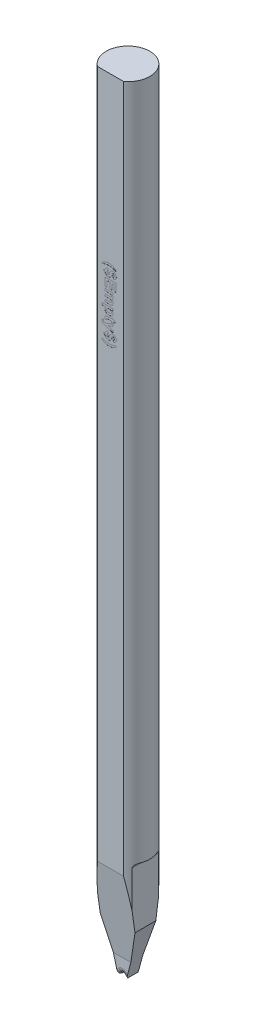
from build123d import *

# Parameters (mm, degrees)
SKETCH_TL_CUTTING_R       = 1.99771
TL_CUTTING_DEPTH          = 72.009
SKETCH_TDF_GRINDING_W     = 4.01542
SKETCH_TDF_GRINDING_H     = 4.01542
TDF_GRINDING_DEPTH        = 73.064400167
ENGRAVING_DEPTH           = 0.005
VW_VR_GRINDING_DEPTH      = 2.00771
VW_VR_GRINDING_DEPTH_BACK = 2.00771
ISA_GRINDING_DEPTH        = 2.00771
ISA_GRINDING_DEPTH_BACK   = 2.00771
PRE_FRX_BRX_DEPTH         = 2.00771
PRE_FRX_BRX_DEPTH_BACK    = 2.00771
SKETCH_PRE_FRX_BRX_W      = 1.46796
SKETCH_PRE_FRX_BRX_H      = 1.4986
FR_EDM_R                  = 0.39878
BR_EDM_R                  = 0.20066
FA_BA_GRINDING_DEPTH      = 2.00771
FA_BA_GRINDING_DEPTH_BACK = 2.00771


with BuildPart() as part:
    # sketch_TL_cutting → TL_cutting (new body)
    with BuildSketch(Plane(origin=(0, 0, 0), x_dir=(1, 0, 0), z_dir=(0, 1, 0))):
        Circle(SKETCH_TL_CUTTING_R)
    extrude(amount=TL_CUTTING_DEPTH)

    # sketch_TDF_grinding → TDF_grinding (cut, through all)
    with BuildSketch(Plane(origin=(0, 0, 0), x_dir=(1, 0, 0), z_dir=(0, 1, 0))):
        with Locations((0, -3.60918)):
            Rectangle(SKETCH_TDF_GRINDING_W, SKETCH_TDF_GRINDING_H)
    extrude(amount=TDF_GRINDING_DEPTH, mode=Mode.SUBTRACT)

    # sketch_engraving → engraving (cut)
    # profile 1 of 9: a face of its own
    with BuildSketch(Plane.XY.offset(1.60147)):
        with BuildLine():
            Line((-0.769230769, 56.611564103), (-0.769230769, 56.726948718))
            add(Edge.make_bspline(
                [(-0.769230769, 56.726948718), (-0.75654381, 56.735663826), (-0.731271202, 56.75302445), (-0.692407522, 56.777108744), (-0.653253405, 56.799807931), (-0.61390654, 56.821057444), (-0.574088198, 56.840594152), (-0.533834647, 56.85827299), (-0.493399806, 56.874882514), (-0.452559629, 56.889379278), (-0.411730957, 56.902372472), (-0.37117072, 56.913933672), (-0.330720232, 56.923167297), (-0.290776237, 56.931412038), (-0.251027852, 56.937272807), (-0.211754164, 56.941765375), (-0.172781576, 56.944468765), (-0.146905785, 56.944754889), (-0.134014423, 56.944897436)],
                knots=[0, 0, 0, 0, 1.083507766, 2.158363427, 3.217863588, 4.26952313, 5.306027247, 6.339424422, 7.364296331, 8.382863073, 9.389381803, 10.380601174, 11.351000725, 12.30983044, 13.25126181, 14.178453692, 15.092502614, 16, 16, 16, 16], degree=3))
            add(Edge.make_bspline(
                [(-0.134014423, 56.944897436), (-0.118183889, 56.944720886), (-0.086756823, 56.944370396), (-0.039956705, 56.941072127), (0.006211299, 56.935593151), (0.051774559, 56.928331702), (0.096653064, 56.918551161), (0.140935004, 56.90698945), (0.184649405, 56.893283306), (0.2131297, 56.882285182), (0.227363782, 56.876788462)],
                knots=[0, 0, 0, 0, 1.026825403, 2.038472649, 3.041589395, 4.042121555, 5.030199178, 6.019908545, 7.010375948, 8, 8, 8, 8], degree=3))
            add(Edge.make_bspline(
                [(0.227363782, 56.876788462), (0.251683724, 56.86662748), (0.300012726, 56.846435406), (0.369571494, 56.810574678), (0.43660795, 56.771337941), (0.478889333, 56.74173111), (0.5, 56.726948718)],
                knots=[0, 0, 0, 0, 1.013799707, 2.014640032, 3.00872983, 4, 4, 4, 4], degree=3))
            Line((0.5, 56.726948718), (0.5, 56.611564103))
            add(Edge.make_bspline(
                [(0.5, 56.611564103), (0.483671183, 56.618120598), (0.451734259, 56.630944202), (0.404403907, 56.648404634), (0.359131946, 56.664765299), (0.315658143, 56.679413628), (0.273946214, 56.69238068), (0.234213299, 56.70413527), (0.196217088, 56.713881677), (0.148045143, 56.725244778), (0.087918925, 56.736328711), (0.014547585, 56.745586625), (-0.060927268, 56.751701265), (-0.111967077, 56.752291015), (-0.137820513, 56.752589744)],
                knots=[0, 0, 0, 0, 0.962863393, 1.883228553, 2.76049045, 3.597092273, 4.393389301, 5.150807945, 5.864262675, 6.539665604, 7.859093728, 9.207470704, 10.585486956, 12, 12, 12, 12], degree=3))
            add(Edge.make_bspline(
                [(-0.137820513, 56.752589744), (-0.155988322, 56.752343487), (-0.192554908, 56.751847842), (-0.247746387, 56.748261408), (-0.303631191, 56.742771672), (-0.359778417, 56.734616456), (-0.415599441, 56.724983778), (-0.470281715, 56.713252997), (-0.523675907, 56.700229417), (-0.558467126, 56.689835667), (-0.575721154, 56.68468109)],
                knots=[0, 0, 0, 0, 0.980476084, 1.97341699, 2.983932057, 4.010380506, 5.034783484, 6.040583597, 7.02826557, 8, 8, 8, 8], degree=3))
            add(Edge.make_bspline(
                [(-0.575721154, 56.68468109), (-0.581680072, 56.682859776), (-0.594203733, 56.679031979), (-0.613643056, 56.671976075), (-0.635084462, 56.664505083), (-0.658352199, 56.655786341), (-0.683499135, 56.646272512), (-0.710430496, 56.635536673), (-0.739235975, 56.623981317), (-0.7590223, 56.615790194), (-0.769230769, 56.611564103)],
                knots=[0, 0, 0, 0, 0.722569934, 1.518601428, 2.397973139, 3.356076064, 4.400297102, 5.516290093, 6.718565658, 8, 8, 8, 8], degree=3))
        make_face()
    # profile 2 of 9: a face of its own
    with BuildSketch(Plane.XY.offset(1.60147)):
        with BuildLine():
            Line((-0.346153846, 56.226948718), (-0.063902244, 56.226948718))
            add(Edge.make_bspline(
                [(-0.063902244, 56.226948718), (-0.060691422, 56.237143266), (-0.054417647, 56.257062868), (-0.043102981, 56.285435864), (-0.03104034, 56.311894737), (-0.017255553, 56.335922913), (-0.002706808, 56.358195401), (0.013349437, 56.378160446), (0.030392388, 56.396185381), (0.048816212, 56.411900426), (0.068263793, 56.425644345), (0.088567069, 56.437911105), (0.110125164, 56.447723618), (0.132438861, 56.456389102), (0.155973296, 56.462652823), (0.180398952, 56.467325467), (0.205875491, 56.469883399), (0.223151848, 56.470317076), (0.231971154, 56.470538462)],
                knots=[0, 0, 0, 0, 1.233471439, 2.410137288, 3.52407584, 4.58730311, 5.604983541, 6.592165279, 7.540854934, 8.464761394, 9.382375568, 10.287963167, 11.198393515, 12.113251355, 13.048281916, 14.005296989, 14.981735836, 16, 16, 16, 16], degree=3))
            add(Edge.make_bspline(
                [(0.231971154, 56.470538462), (0.240862374, 56.470369834), (0.258371063, 56.47003777), (0.284035262, 56.466710465), (0.308630388, 56.461512705), (0.332214124, 56.454327878), (0.354666156, 56.444872426), (0.375999861, 56.433410852), (0.396225213, 56.419891645), (0.415061575, 56.404246572), (0.432812136, 56.387237259), (0.448139285, 56.36818408), (0.461933462, 56.348127842), (0.473588781, 56.326562978), (0.483166571, 56.303572929), (0.491049568, 56.279359162), (0.496663149, 56.253639945), (0.49887037, 56.235984548), (0.5, 56.226948718)],
                knots=[0, 0, 0, 0, 1.065419917, 2.098036635, 3.096580821, 4.076501369, 5.04880669, 6.012240184, 6.975806694, 7.959773282, 8.944748783, 9.917449457, 10.885494533, 11.859775015, 12.849941464, 13.867618658, 14.908671599, 16, 16, 16, 16], degree=3))
            Line((0.5, 56.226948718), (0.576923077, 56.226948718))
            Line((0.576923077, 56.226948718), (0.576923077, 56.124384615))
            Line((0.576923077, 56.124384615), (0.5, 56.124384615))
            add(Edge.make_bspline(
                [(0.5, 56.124384615), (0.498841424, 56.115486686), (0.496573389, 56.09806805), (0.49137632, 56.072741064), (0.484539762, 56.048860422), (0.476339583, 56.026349842), (0.466697028, 56.005143702), (0.455518194, 55.985361964), (0.442840864, 55.966933141), (0.428527318, 55.95018479), (0.413145824, 55.934584638), (0.39610941, 55.920827789), (0.378155721, 55.908112331), (0.358829355, 55.897061433), (0.338178987, 55.887674614), (0.316411919, 55.87941047), (0.293274546, 55.872799442), (0.27733531, 55.869600771), (0.269230769, 55.867974359)],
                knots=[0, 0, 0, 0, 1.151887312, 2.254940947, 3.31604567, 4.338626222, 5.328478017, 6.30366564, 7.252607131, 8.195603958, 9.129238937, 10.061258459, 11.003163313, 11.951756149, 12.914654824, 13.913120779, 14.938895277, 16, 16, 16, 16], degree=3))
            Line((0.269230769, 55.867974359), (0.243589744, 56.034641026))
            add(Edge.make_bspline(
                [(0.243589744, 56.034641026), (0.250446456, 56.036643558), (0.263771485, 56.040535192), (0.282535036, 56.048465441), (0.299671316, 56.057678859), (0.315110354, 56.068227628), (0.328747964, 56.080224188), (0.340615646, 56.09355588), (0.351026936, 56.108191319), (0.356312409, 56.118960751), (0.358974359, 56.124384615)],
                knots=[0, 0, 0, 0, 1.132612369, 2.201068414, 3.225051706, 4.215432487, 5.161289188, 6.099220658, 7.04270083, 8, 8, 8, 8], degree=3))
            Line((0.358974359, 56.124384615), (0.095552885, 56.124384615))
            add(Edge.make_bspline(
                [(0.095552885, 56.124384615), (0.091846888, 56.111134392), (0.084711092, 56.085621445), (0.072793936, 56.049230821), (0.059721416, 56.016296736), (0.046029912, 55.986577051), (0.031359337, 55.960199095), (0.016057305, 55.936950063), (-0.000406851, 55.917264806), (-0.017692985, 55.90057685), (-0.036309981, 55.887032312), (-0.055531671, 55.874731893), (-0.076319964, 55.864821076), (-0.098285192, 55.856514134), (-0.121510852, 55.850207549), (-0.145938277, 55.845497559), (-0.171622588, 55.842996815), (-0.189164574, 55.842557523), (-0.198116987, 55.842333333)],
                knots=[0, 0, 0, 0, 1.47567488, 2.841372022, 4.104837161, 5.274356171, 6.348422789, 7.339634063, 8.254806618, 9.095728451, 9.909336987, 10.720135121, 11.540149133, 12.374211184, 13.236039526, 14.118162803, 15.039619326, 16, 16, 16, 16], degree=3))
            add(Edge.make_bspline(
                [(-0.198116987, 55.842333333), (-0.208142, 55.842575379), (-0.227850116, 55.843051216), (-0.256821167, 55.846471811), (-0.284551423, 55.852320659), (-0.311143037, 55.860302461), (-0.336478096, 55.870703856), (-0.360449465, 55.883721867), (-0.383339011, 55.898751156), (-0.405018236, 55.915957227), (-0.425053345, 55.935437905), (-0.443316442, 55.956889482), (-0.459578741, 55.980293772), (-0.474036034, 56.005432354), (-0.486703174, 56.032431862), (-0.497491454, 56.061298177), (-0.506369109, 56.092117722), (-0.510637243, 56.113464927), (-0.512820513, 56.124384615)],
                knots=[0, 0, 0, 0, 1.03830894, 2.041205585, 3.016534218, 3.970513834, 4.913295289, 5.847846025, 6.791667113, 7.746548932, 8.710133323, 9.681653264, 10.66021374, 11.657945465, 12.682082278, 13.745789509, 14.84690868, 16, 16, 16, 16], degree=3))
            Line((-0.512820513, 56.124384615), (-0.641025641, 56.124384615))
            Line((-0.641025641, 56.124384615), (-0.641025641, 56.226948718))
            Line((-0.641025641, 56.226948718), (-0.512820513, 56.226948718))
            add(Edge.make_bspline(
                [(-0.512820513, 56.226948718), (-0.511365569, 56.235993376), (-0.508497729, 56.253821301), (-0.501708114, 56.279680106), (-0.493672179, 56.304444222), (-0.483362821, 56.327734513), (-0.471282985, 56.349710338), (-0.457442831, 56.370330001), (-0.441914521, 56.389778959), (-0.424444795, 56.407782199), (-0.405185733, 56.424467381), (-0.384010208, 56.4395823), (-0.360904849, 56.452986013), (-0.335919458, 56.464741317), (-0.309230571, 56.475320078), (-0.280464835, 56.483703551), (-0.249946988, 56.491100501), (-0.228795072, 56.494457879), (-0.217948718, 56.496179487)],
                knots=[0, 0, 0, 0, 1.014565868, 1.999810643, 2.959153021, 3.896762473, 4.817401281, 5.734733625, 6.645326844, 7.571538865, 8.510548692, 9.465314575, 10.450114695, 11.466190414, 12.522838407, 13.627737783, 14.783543095, 16, 16, 16, 16], degree=3))
            Line((-0.217948718, 56.496179487), (-0.192307692, 56.329512821))
            add(Edge.make_bspline(
                [(-0.192307692, 56.329512821), (-0.201304383, 56.327560775), (-0.218871734, 56.323749123), (-0.243936875, 56.315017324), (-0.267070938, 56.304026951), (-0.287973212, 56.290797737), (-0.306574231, 56.276291657), (-0.322506138, 56.260740348), (-0.336055086, 56.244580368), (-0.342841228, 56.232732292), (-0.346153846, 56.226948718)],
                knots=[0, 0, 0, 0, 1.156277083, 2.257799727, 3.327693098, 4.368586128, 5.360870913, 6.286760294, 7.163691387, 8, 8, 8, 8], degree=3))
        make_face()
        with BuildLine():
            add(Edge.make_bspline(
                [(0.358974359, 56.226948718), (0.356717333, 56.232992086), (0.352323078, 56.244758059), (0.342207363, 56.260507034), (0.329671684, 56.273923048), (0.314627801, 56.284702628), (0.298154817, 56.293142912), (0.280699719, 56.299552483), (0.262303768, 56.303185993), (0.249748228, 56.303641235), (0.243389423, 56.303871795)],
                knots=[0, 0, 0, 0, 1.038261919, 2.021415961, 2.996868165, 3.983674221, 4.990617688, 5.975363788, 6.97461459, 8, 8, 8, 8], degree=3))
            add(Edge.make_bspline(
                [(0.243389423, 56.303871795), (0.23756032, 56.303721402), (0.225998475, 56.303423102), (0.209074665, 56.29974233), (0.192634157, 56.29441819), (0.177010257, 56.286573685), (0.16226258, 56.276278866), (0.149112783, 56.262726829), (0.137430451, 56.24612493), (0.131236645, 56.233523802), (0.128004808, 56.226948718)],
                knots=[0, 0, 0, 0, 0.946787839, 1.877924175, 2.805567745, 3.753041052, 4.711661487, 5.718097864, 6.809336945, 8, 8, 8, 8], degree=3))
            Line((0.128004808, 56.226948718), (0.358974359, 56.226948718))
        make_face(mode=Mode.SUBTRACT)
        with BuildLine():
            add(Edge.make_bspline(
                [(-0.346153846, 56.124384615), (-0.345705345, 56.116185175), (-0.34483103, 56.100201084), (-0.337601638, 56.077493624), (-0.325657788, 56.057310262), (-0.309263795, 56.040179958), (-0.289891882, 56.026342959), (-0.268342869, 56.016345675), (-0.24520997, 56.010077578), (-0.229139944, 56.009363677), (-0.220953526, 56.009)],
                knots=[0, 0, 0, 0, 1.03495557, 2.017555319, 2.978963058, 3.976357979, 4.993109917, 5.971347703, 6.966560647, 8, 8, 8, 8], degree=3))
            add(Edge.make_bspline(
                [(-0.220953526, 56.009), (-0.213643973, 56.009272343), (-0.199375663, 56.00980396), (-0.178751062, 56.015029744), (-0.159765904, 56.023484931), (-0.142238273, 56.03538561), (-0.126537208, 56.051348938), (-0.113258624, 56.071844849), (-0.101443075, 56.096373029), (-0.09589405, 56.114671881), (-0.092948718, 56.124384615)],
                knots=[0, 0, 0, 0, 0.934982296, 1.825093612, 2.705865091, 3.586179448, 4.523819282, 5.553563867, 6.701471314, 8, 8, 8, 8], degree=3))
            Line((-0.092948718, 56.124384615), (-0.346153846, 56.124384615))
        make_face(mode=Mode.SUBTRACT)
    # profile 3 of 9: a face of its own
    with BuildSketch(Plane.XY.offset(1.60147)):
        Polygon((-0.5, 55.675666667), (0.5, 55.675666667), (0.5, 54.932076923), (0.333333333, 54.932076923), (0.333333333, 55.483358974), (0.115384615, 55.483358974), (0.115384615, 54.970538462), (-0.051282051, 54.970538462), (-0.051282051, 55.483358974), (-0.333333333, 55.483358974), (-0.333333333, 54.91925641), (-0.5, 54.91925641), align=None)
    # profile 4 of 9: a face of its own
    with BuildSketch(Plane.XY.offset(1.60147)):
        with BuildLine():
            Line((0.230769231, 54.778230769), (0.230769231, 54.585923077))
            Line((0.230769231, 54.585923077), (0.1328125, 54.585923077))
            add(Edge.make_bspline(
                [(0.1328125, 54.585923077), (0.141664699, 54.578359049), (0.158931351, 54.563605038), (0.181382685, 54.538923789), (0.200586186, 54.513416739), (0.21644089, 54.486832809), (0.228531159, 54.458934117), (0.237134296, 54.429946875), (0.242539521, 54.399891949), (0.243237377, 54.379481895), (0.243589744, 54.369176282)],
                knots=[0, 0, 0, 0, 1.107940857, 2.161093632, 3.169644562, 4.144639019, 5.101548547, 6.057210626, 7.019030711, 8, 8, 8, 8], degree=3))
            add(Edge.make_bspline(
                [(0.243589744, 54.369176282), (0.243215794, 54.358410033), (0.242486901, 54.337424744), (0.237632212, 54.306967189), (0.228624904, 54.278890488), (0.216596826, 54.25293503), (0.200997643, 54.229186923), (0.181697421, 54.207803483), (0.1589088, 54.188570942), (0.141647297, 54.178047815), (0.1328125, 54.172661859)],
                knots=[0, 0, 0, 0, 1.087442074, 2.119613481, 3.102840357, 4.056171906, 5.000733146, 5.960649063, 6.95621775, 8, 8, 8, 8], degree=3))
            add(Edge.make_bspline(
                [(0.1328125, 54.172661859), (0.141648331, 54.164741809), (0.15890459, 54.149274061), (0.18160607, 54.123912536), (0.200837622, 54.097588586), (0.216342266, 54.070185607), (0.228440547, 54.041886572), (0.237463475, 54.012736515), (0.242455792, 53.982395313), (0.243209151, 53.961874823), (0.243589744, 53.951508013)],
                knots=[0, 0, 0, 0, 1.113355786, 2.174368662, 3.188819075, 4.168565139, 5.12342631, 6.073356391, 7.026672896, 8, 8, 8, 8], degree=3))
            add(Edge.make_bspline(
                [(0.243589744, 53.951508013), (0.243253707, 53.938725949), (0.242603687, 53.914000698), (0.236233833, 53.878451934), (0.226092646, 53.845846208), (0.211825029, 53.816371427), (0.193628332, 53.79007465), (0.171312748, 53.767536921), (0.145297956, 53.748199279), (0.125650654, 53.738783721), (0.115584936, 53.733959936)],
                knots=[0, 0, 0, 0, 1.140905914, 2.206935121, 3.214358517, 4.182792527, 5.121068659, 6.057503675, 7.004819049, 8, 8, 8, 8], degree=3))
            add(Edge.make_bspline(
                [(0.115584936, 53.733959936), (0.1114006, 53.732358143), (0.102614163, 53.728994633), (0.088193677, 53.7250406), (0.07205936, 53.721717836), (0.05407705, 53.718900231), (0.034354022, 53.716783997), (0.012779717, 53.715109993), (-0.010546601, 53.714459858), (-0.026709385, 53.714241149), (-0.03505609, 53.714128205)],
                knots=[0, 0, 0, 0, 0.70348757, 1.477211565, 2.345356006, 3.290383569, 4.335215205, 5.460703428, 6.68866909, 8, 8, 8, 8], degree=3))
            Line((-0.03505609, 53.714128205), (-0.5, 53.714128205))
            Line((-0.5, 53.714128205), (-0.5, 53.906435897))
            Line((-0.5, 53.906435897), (-0.080128205, 53.906435897))
            add(Edge.make_bspline(
                [(-0.080128205, 53.906435897), (-0.07144761, 53.906547935), (-0.054817384, 53.906762576), (-0.031090468, 53.907406731), (-0.009777274, 53.909044643), (0.009076857, 53.911186366), (0.025551617, 53.91391905), (0.039613136, 53.917295096), (0.051411557, 53.921089266), (0.058064109, 53.924645803), (0.061097756, 53.926267628)],
                knots=[0, 0, 0, 0, 1.448583407, 2.775186282, 3.959557885, 5.014017743, 5.940851432, 6.743435621, 7.42699079, 8, 8, 8, 8], degree=3))
            add(Edge.make_bspline(
                [(0.061097756, 53.926267628), (0.0644449, 53.928508242), (0.071015994, 53.932907002), (0.079428524, 53.94104351), (0.086594396, 53.949987573), (0.092366124, 53.959872082), (0.097066603, 53.970530677), (0.100204228, 53.982148841), (0.10230955, 53.994633517), (0.102477414, 54.003314837), (0.102564103, 54.007798077)],
                knots=[0, 0, 0, 0, 1.007330723, 1.977586358, 2.91811154, 3.870610884, 4.837109745, 5.827490497, 6.87806446, 8, 8, 8, 8], degree=3))
            add(Edge.make_bspline(
                [(0.102564103, 54.007798077), (0.102240034, 54.01443365), (0.101593875, 54.027664313), (0.09685111, 54.047122239), (0.088810593, 54.065848966), (0.077873982, 54.083699946), (0.064089543, 54.100338814), (0.046951113, 54.114414723), (0.027058253, 54.126184107), (0.008201325, 54.133566057), (-0.008714124, 54.138275058), (-0.023370098, 54.141428886), (-0.039736185, 54.144230026), (-0.057919723, 54.146426211), (-0.07777632, 54.14791842), (-0.09941442, 54.149127695), (-0.122723067, 54.149973668), (-0.138888099, 54.150007942), (-0.147235577, 54.150025641)],
                knots=[0, 0, 0, 0, 0.980909897, 1.955835539, 2.942693402, 3.98436442, 5.042755257, 6.12263035, 7.247279534, 8.448501813, 9.105087946, 9.843148781, 10.66469806, 11.560151265, 12.550905382, 13.609296218, 14.765461946, 16, 16, 16, 16], degree=3))
            Line((-0.147235577, 54.150025641), (-0.5, 54.150025641))
            Line((-0.5, 54.150025641), (-0.5, 54.342333333))
            Line((-0.5, 54.342333333), (-0.097355769, 54.342333333))
            add(Edge.make_bspline(
                [(-0.097355769, 54.342333333), (-0.088808683, 54.342387673), (-0.072514885, 54.342491264), (-0.049272866, 54.342832415), (-0.028431625, 54.343598963), (-0.010001412, 54.344816338), (0.006094573, 54.346219335), (0.019817647, 54.347693711), (0.031211059, 54.3496468), (0.042972639, 54.352762901), (0.055281064, 54.357674574), (0.068015353, 54.364905367), (0.078952496, 54.37337508), (0.087734398, 54.383592499), (0.094431133, 54.39552783), (0.099289836, 54.409190268), (0.101996826, 54.424759663), (0.102369061, 54.435739069), (0.102564103, 54.441491987)],
                knots=[0, 0, 0, 0, 1.59941463, 3.049055322, 4.349500855, 5.501487129, 6.504910079, 7.372843676, 8.083634967, 8.665560774, 9.647038445, 10.55368294, 11.398647399, 12.222657519, 13.056461931, 13.945719492, 14.92361148, 16, 16, 16, 16], degree=3))
            add(Edge.make_bspline(
                [(0.102564103, 54.441491987), (0.102234348, 54.448658367), (0.101586917, 54.462728621), (0.097099356, 54.483322194), (0.089385598, 54.502697199), (0.078745529, 54.520760574), (0.065308531, 54.537164364), (0.048811546, 54.551063128), (0.02977557, 54.562600394), (0.011740073, 54.569890429), (-0.004479026, 54.57462018), (-0.018770373, 54.57751101), (-0.034874654, 54.580111233), (-0.052844538, 54.58232052), (-0.072766981, 54.583839446), (-0.094540599, 54.585014918), (-0.118182385, 54.585875318), (-0.134547779, 54.585906775), (-0.143028846, 54.585923077)],
                knots=[0, 0, 0, 0, 1.061105177, 2.08334182, 3.104381884, 4.137278018, 5.176827868, 6.229094397, 7.316239487, 8.460364206, 9.09881589, 9.816452537, 10.617971519, 11.514628853, 12.496857794, 13.576419947, 14.74402393, 16, 16, 16, 16], degree=3))
            Line((-0.143028846, 54.585923077), (-0.5, 54.585923077))
            Line((-0.5, 54.585923077), (-0.5, 54.778230769))
            Line((-0.5, 54.778230769), (0.230769231, 54.778230769))
        make_face()
    # profile 5 of 9: a face of its own
    with BuildSketch(Plane.XY.offset(1.60147)):
        with BuildLine():
            Line((0.230769231, 53.521820513), (0.230769231, 53.329512821))
            Line((0.230769231, 53.329512821), (0.125400641, 53.329512821))
            add(Edge.make_bspline(
                [(0.125400641, 53.329512821), (0.134110558, 53.323789731), (0.151482958, 53.312374718), (0.174623276, 53.291319889), (0.194727471, 53.267179744), (0.21216262, 53.240640955), (0.226252501, 53.211806915), (0.236247247, 53.181133514), (0.242498657, 53.148943396), (0.243222023, 53.126950728), (0.243589744, 53.115770833)],
                knots=[0, 0, 0, 0, 0.978547196, 1.95176541, 2.927409496, 3.924956672, 4.929940552, 5.934297003, 6.949907262, 8, 8, 8, 8], degree=3))
            add(Edge.make_bspline(
                [(0.243589744, 53.115770833), (0.243275199, 53.106003359), (0.242653327, 53.086692556), (0.237904657, 53.058336182), (0.230300531, 53.031019066), (0.219424348, 53.00483804), (0.205256392, 52.979900966), (0.188112758, 52.956138662), (0.167850875, 52.933577666), (0.144791975, 52.912281795), (0.118886648, 52.892784547), (0.090438984, 52.875746955), (0.059420431, 52.861512172), (0.02614289, 52.849614093), (-0.00973483, 52.840790018), (-0.047865347, 52.834089032), (-0.088468702, 52.830383122), (-0.116312431, 52.82980808), (-0.130608974, 52.829512821)],
                knots=[0, 0, 0, 0, 0.889183518, 1.757962001, 2.610823862, 3.466866804, 4.332788647, 5.217155532, 6.130223362, 7.089913047, 8.071415563, 9.077827182, 10.103546864, 11.174887114, 12.291391641, 13.464112916, 14.69793237, 16, 16, 16, 16], degree=3))
            add(Edge.make_bspline(
                [(-0.130608974, 52.829512821), (-0.145309675, 52.829777446), (-0.173899782, 52.830292094), (-0.215458383, 52.834402127), (-0.254585771, 52.840776506), (-0.291083626, 52.85058219), (-0.325347568, 52.862394954), (-0.356921697, 52.877327394), (-0.386073852, 52.894801106), (-0.412336985, 52.915059239), (-0.435948519, 52.936992733), (-0.456547424, 52.960307103), (-0.473866574, 52.984832979), (-0.488041441, 53.010500814), (-0.499108447, 53.03731691), (-0.507216556, 53.065229904), (-0.511869709, 53.094380749), (-0.512500462, 53.114152095), (-0.512820513, 53.124184295)],
                knots=[0, 0, 0, 0, 1.306276956, 2.54046374, 3.708317787, 4.825351227, 5.895229917, 6.925275359, 7.923721025, 8.910100439, 9.867470588, 10.784172372, 11.670002506, 12.530604141, 13.384735846, 14.243124713, 15.108541968, 16, 16, 16, 16], degree=3))
            add(Edge.make_bspline(
                [(-0.512820513, 53.124184295), (-0.512609167, 53.133690186), (-0.512194245, 53.152352468), (-0.507198627, 53.179557904), (-0.500287281, 53.205588151), (-0.489449809, 53.230441328), (-0.475076841, 53.254817244), (-0.456848814, 53.279593251), (-0.434276455, 53.304830916), (-0.417064851, 53.321030662), (-0.408052885, 53.329512821)],
                knots=[0, 0, 0, 0, 0.955822701, 1.876503125, 2.776905967, 3.662325514, 4.596312032, 5.620965962, 6.754341905, 8, 8, 8, 8], degree=3))
            Line((-0.408052885, 53.329512821), (-0.769230769, 53.329512821))
            Line((-0.769230769, 53.329512821), (-0.769230769, 53.521820513))
            Line((-0.769230769, 53.521820513), (0.230769231, 53.521820513))
        make_face()
        with BuildLine():
            add(Edge.make_bspline(
                [(-0.122195513, 53.329512821), (-0.132481435, 53.329330938), (-0.152405274, 53.328978631), (-0.181244648, 53.327077339), (-0.208037309, 53.323546885), (-0.232684253, 53.318235747), (-0.255441334, 53.312050174), (-0.275988928, 53.303930804), (-0.294539024, 53.294622167), (-0.310824186, 53.283698167), (-0.325130191, 53.271818833), (-0.337524496, 53.259247515), (-0.348144327, 53.246075436), (-0.356821345, 53.23224956), (-0.363446941, 53.217669312), (-0.368372821, 53.202507368), (-0.371163803, 53.186653237), (-0.371583715, 53.175877184), (-0.371794872, 53.170458333)],
                knots=[0, 0, 0, 0, 1.493314022, 2.892550594, 4.193549699, 5.412205958, 6.550654332, 7.612709232, 8.614154521, 9.557822924, 10.452682187, 11.309508678, 12.116407821, 12.904513946, 13.672267114, 14.435601522, 15.213325928, 16, 16, 16, 16], degree=3))
            add(Edge.make_bspline(
                [(-0.371794872, 53.170458333), (-0.371659076, 53.165238996), (-0.371390934, 53.154932918), (-0.368717534, 53.139850329), (-0.36428733, 53.1254401), (-0.35796517, 53.111782234), (-0.350180339, 53.098647389), (-0.340400371, 53.086335676), (-0.328879204, 53.074787269), (-0.315890023, 53.063521873), (-0.300495775, 53.053808804), (-0.283066961, 53.045116707), (-0.26342759, 53.037702345), (-0.241425455, 53.032059812), (-0.21727146, 53.027453704), (-0.190916328, 53.02410908), (-0.162291664, 53.022084026), (-0.142498204, 53.021910628), (-0.132211538, 53.021820513)],
                knots=[0, 0, 0, 0, 0.791436533, 1.562766886, 2.315979036, 3.073269983, 3.841398674, 4.627954771, 5.451998839, 6.314818792, 7.231140921, 8.205467689, 9.266952699, 10.409907015, 11.648037837, 12.996681567, 14.439174734, 16, 16, 16, 16], degree=3))
            add(Edge.make_bspline(
                [(-0.132211538, 53.021820513), (-0.122590159, 53.021885744), (-0.103987384, 53.022011868), (-0.077055352, 53.024396462), (-0.051997139, 53.027603604), (-0.028873936, 53.032518131), (-0.007518455, 53.038306551), (0.01172948, 53.046020618), (0.029199081, 53.054792491), (0.044606747, 53.065096056), (0.058319539, 53.076225976), (0.069887203, 53.088411635), (0.080128065, 53.10083484), (0.08840061, 53.11408001), (0.094621072, 53.128151434), (0.099305551, 53.142696751), (0.101912651, 53.158013515), (0.102344136, 53.168379172), (0.102564103, 53.173663462)],
                knots=[0, 0, 0, 0, 1.476459806, 2.854710082, 4.147877, 5.352136794, 6.481419541, 7.539804139, 8.530071065, 9.476830027, 10.379846701, 11.23529603, 12.051777807, 12.848258948, 13.623682229, 14.408266492, 15.188553102, 16, 16, 16, 16], degree=3))
            add(Edge.make_bspline(
                [(0.102564103, 53.173663462), (0.102455308, 53.179153683), (0.102241498, 53.189943463), (0.099201363, 53.205705699), (0.094853437, 53.220854844), (0.088686029, 53.235317083), (0.080452533, 53.248825762), (0.070807323, 53.261847745), (0.059117992, 53.273947129), (0.045859614, 53.285459774), (0.030812699, 53.295916203), (0.01390315, 53.304896172), (-0.00466452, 53.312440447), (-0.024767533, 53.318971117), (-0.046730612, 53.323669687), (-0.070369893, 53.326944967), (-0.095705859, 53.329315572), (-0.113175154, 53.329445653), (-0.122195513, 53.329512821)],
                knots=[0, 0, 0, 0, 0.85812159, 1.686442648, 2.503408574, 3.322778131, 4.138405645, 4.97460315, 5.854412976, 6.765937777, 7.719865152, 8.715925653, 9.756353289, 10.85381274, 12.020422519, 13.266547949, 14.588568337, 16, 16, 16, 16], degree=3))
        make_face(mode=Mode.SUBTRACT)
    # profile 6 of 9: a face of its own
    with BuildSketch(Plane.XY.offset(1.60147)):
        with BuildLine():
            Line((0.230769231, 52.329512821), (0.08974359, 52.329512821))
            Line((0.08974359, 52.329512821), (0.08974359, 52.470538462))
            Line((0.08974359, 52.470538462), (-0.224358974, 52.470538462))
            add(Edge.make_bspline(
                [(-0.224358974, 52.470538462), (-0.231904339, 52.47055171), (-0.246127351, 52.470576684), (-0.266228543, 52.470412391), (-0.283853768, 52.469932133), (-0.299018236, 52.469649783), (-0.311701045, 52.46897022), (-0.321861303, 52.468462927), (-0.329566697, 52.467740323), (-0.338907815, 52.466012609), (-0.35057578, 52.46098511), (-0.360389431, 52.451317637), (-0.366182432, 52.44179528), (-0.369474906, 52.433766405), (-0.371514578, 52.424967167), (-0.371700117, 52.418800144), (-0.371794872, 52.415650641)],
                knots=[0, 0, 0, 0, 1.773599637, 3.343235314, 4.724802322, 5.918078765, 6.908020279, 7.709878159, 8.309605123, 8.725167438, 9.94114383, 11.228754835, 11.890951744, 12.552590386, 13.260806876, 14, 14, 14, 14], degree=3))
            add(Edge.make_bspline(
                [(-0.371794872, 52.415650641), (-0.371507964, 52.410495649), (-0.37087716, 52.399161728), (-0.367095421, 52.380687003), (-0.361305779, 52.35922894), (-0.356131124, 52.344040802), (-0.353365385, 52.335923077)],
                knots=[0, 0, 0, 0, 0.75345353, 1.656565626, 2.747486109, 4, 4, 4, 4], degree=3))
            Line((-0.353365385, 52.335923077), (-0.487379808, 52.316692308))
            add(Edge.make_bspline(
                [(-0.487379808, 52.316692308), (-0.491390152, 52.328369641), (-0.499569528, 52.352186373), (-0.506906498, 52.3900411), (-0.512003384, 52.42993354), (-0.512543433, 52.457299316), (-0.512820513, 52.471339744)],
                knots=[0, 0, 0, 0, 0.939563481, 1.916305015, 2.930928536, 4, 4, 4, 4], degree=3))
            add(Edge.make_bspline(
                [(-0.512820513, 52.471339744), (-0.512564303, 52.479962381), (-0.512063975, 52.49680071), (-0.50889268, 52.521457549), (-0.50326966, 52.544746429), (-0.495519476, 52.566499989), (-0.485995694, 52.586145599), (-0.475305475, 52.603448436), (-0.462868601, 52.617641671), (-0.449141562, 52.629497462), (-0.433202705, 52.638848766), (-0.415065056, 52.646272715), (-0.394648734, 52.652652966), (-0.380046946, 52.655266675), (-0.372395833, 52.656636218)],
                knots=[0, 0, 0, 0, 1.203015215, 2.349253984, 3.460901624, 4.539344044, 5.564274864, 6.502382232, 7.367332183, 8.186789841, 9.022345106, 9.932420497, 10.916620053, 12, 12, 12, 12], degree=3))
            add(Edge.make_bspline(
                [(-0.372395833, 52.656636218), (-0.369192653, 52.657116428), (-0.362066116, 52.658184813), (-0.35025766, 52.659634383), (-0.336212257, 52.660528825), (-0.319980191, 52.661261789), (-0.301558032, 52.662201997), (-0.280981809, 52.662400781), (-0.258215711, 52.66297611), (-0.242321525, 52.662890903), (-0.233974359, 52.662846154)],
                knots=[0, 0, 0, 0, 0.560521704, 1.24706641, 2.057998689, 2.995119087, 4.059211621, 5.249632546, 6.555586685, 8, 8, 8, 8], degree=3))
            Line((-0.233974359, 52.662846154), (0.08974359, 52.662846154))
            Line((0.08974359, 52.662846154), (0.08974359, 52.752589744))
            Line((0.08974359, 52.752589744), (0.230769231, 52.752589744))
            Line((0.230769231, 52.752589744), (0.230769231, 52.662846154))
            Line((0.230769231, 52.662846154), (0.371794872, 52.662846154))
            Line((0.371794872, 52.662846154), (0.487179487, 52.470538462))
            Line((0.487179487, 52.470538462), (0.230769231, 52.470538462))
            Line((0.230769231, 52.470538462), (0.230769231, 52.329512821))
        make_face()
    # profile 7 of 9: a face of its own
    with BuildSketch(Plane.XY.offset(1.60147)):
        with BuildLine():
            Line((0.230769231, 52.303871795), (0.230769231, 52.111564103))
            Line((0.230769231, 52.111564103), (-0.286658654, 51.951307692))
            Line((-0.286658654, 51.951307692), (0.230769231, 51.791051282))
            Line((0.230769231, 51.791051282), (0.230769231, 51.59874359))
            Line((0.230769231, 51.59874359), (-0.466145833, 51.841732372))
            Line((-0.466145833, 51.841732372), (-0.598157051, 51.88780609))
            add(Edge.make_bspline(
                [(-0.598157051, 51.88780609), (-0.607606652, 51.89159762), (-0.625376306, 51.898727464), (-0.650028536, 51.910049297), (-0.671175741, 51.920862611), (-0.689167457, 51.931709184), (-0.704516652, 51.942913706), (-0.717943024, 51.954827994), (-0.730162212, 51.967284886), (-0.740813451, 51.980793571), (-0.750254429, 51.995532496), (-0.758328481, 52.011776596), (-0.76563939, 52.029473804), (-0.771559687, 52.048799905), (-0.776455479, 52.06952306), (-0.779384556, 52.091675696), (-0.781869716, 52.114981275), (-0.781989673, 52.130987518), (-0.782051282, 52.139208333)],
                knots=[0, 0, 0, 0, 1.442318569, 2.712231111, 3.841952651, 4.805677934, 5.685519496, 6.530069912, 7.346275571, 8.154437428, 8.962710014, 9.821550927, 10.7210084, 11.672490954, 12.682200373, 13.733763549, 14.836059795, 16, 16, 16, 16], degree=3))
            add(Edge.make_bspline(
                [(-0.782051282, 52.139208333), (-0.7816451, 52.156217724), (-0.780837731, 52.190027353), (-0.77455582, 52.223257127), (-0.771434295, 52.239769231)],
                knots=[0, 0, 0, 0, 1.006186215, 2, 2, 2, 2], degree=3))
            Line((-0.771434295, 52.239769231), (-0.632011218, 52.252589744))
            add(Edge.make_bspline(
                [(-0.632011218, 52.252589744), (-0.633415338, 52.245992157), (-0.636126927, 52.233251116), (-0.638960851, 52.214460996), (-0.640597369, 52.196662949), (-0.640885825, 52.185084749), (-0.641025641, 52.179472756)],
                knots=[0, 0, 0, 0, 1.096454798, 2.117437249, 3.087515614, 4, 4, 4, 4], degree=3))
            add(Edge.make_bspline(
                [(-0.641025641, 52.179472756), (-0.64091732, 52.174592773), (-0.640708773, 52.165197485), (-0.638908081, 52.151550373), (-0.635715822, 52.138918389), (-0.631252096, 52.127272811), (-0.625903073, 52.116443406), (-0.618924188, 52.106731769), (-0.610797334, 52.097950602), (-0.597999124, 52.087623602), (-0.579899103, 52.076234316), (-0.555710912, 52.064504301), (-0.528917644, 52.054174693), (-0.509869412, 52.048960982), (-0.5, 52.046259615)],
                knots=[0, 0, 0, 0, 0.826282398, 1.5908173, 2.325927711, 3.027474672, 3.700169566, 4.365407898, 5.04557163, 5.720354759, 7.144619778, 8.656909909, 10.267853154, 12, 12, 12, 12], degree=3))
            Line((-0.5, 52.046259615), (0.230769231, 52.303871795))
        make_face()
    # profile 8 of 9: a face of its own
    with BuildSketch(Plane.XY.offset(1.60147)):
        with BuildLine():
            Line((-0.346153846, 51.226948718), (-0.063902244, 51.226948718))
            add(Edge.make_bspline(
                [(-0.063902244, 51.226948718), (-0.060691422, 51.237143266), (-0.054417647, 51.257062868), (-0.043102981, 51.285435864), (-0.03104034, 51.311894737), (-0.017255553, 51.335922913), (-0.002706808, 51.358195401), (0.013349437, 51.378160446), (0.030392388, 51.396185381), (0.048816212, 51.411900426), (0.068263793, 51.425644345), (0.088567069, 51.437911105), (0.110125164, 51.447723618), (0.132438861, 51.456389102), (0.155973296, 51.462652823), (0.180398952, 51.467325467), (0.205875491, 51.469883399), (0.223151848, 51.470317076), (0.231971154, 51.470538462)],
                knots=[0, 0, 0, 0, 1.233471439, 2.410137288, 3.52407584, 4.58730311, 5.604983541, 6.592165279, 7.540854934, 8.464761394, 9.382375568, 10.287963167, 11.198393515, 12.113251355, 13.048281916, 14.005296989, 14.981735836, 16, 16, 16, 16], degree=3))
            add(Edge.make_bspline(
                [(0.231971154, 51.470538462), (0.240862374, 51.470369834), (0.258371063, 51.47003777), (0.284035262, 51.466710465), (0.308630388, 51.461512705), (0.332214124, 51.454327878), (0.354666156, 51.444872426), (0.375999861, 51.433410852), (0.396225213, 51.419891645), (0.415061575, 51.404246572), (0.432812136, 51.387237259), (0.448139285, 51.36818408), (0.461933462, 51.348127842), (0.473588781, 51.326562978), (0.483166571, 51.303572929), (0.491049568, 51.279359162), (0.496663149, 51.253639945), (0.49887037, 51.235984548), (0.5, 51.226948718)],
                knots=[0, 0, 0, 0, 1.065419917, 2.098036635, 3.096580821, 4.076501369, 5.04880669, 6.012240184, 6.975806694, 7.959773282, 8.944748783, 9.917449457, 10.885494533, 11.859775015, 12.849941464, 13.867618658, 14.908671599, 16, 16, 16, 16], degree=3))
            Line((0.5, 51.226948718), (0.576923077, 51.226948718))
            Line((0.576923077, 51.226948718), (0.576923077, 51.124384615))
            Line((0.576923077, 51.124384615), (0.5, 51.124384615))
            add(Edge.make_bspline(
                [(0.5, 51.124384615), (0.498841424, 51.115486686), (0.496573389, 51.09806805), (0.49137632, 51.072741064), (0.484539762, 51.048860422), (0.476339583, 51.026349842), (0.466697028, 51.005143702), (0.455518194, 50.985361964), (0.442840864, 50.966933141), (0.428527318, 50.95018479), (0.413145824, 50.934584638), (0.39610941, 50.920827789), (0.378155721, 50.908112331), (0.358829355, 50.897061433), (0.338178987, 50.887674614), (0.316411919, 50.87941047), (0.293274546, 50.872799442), (0.27733531, 50.869600771), (0.269230769, 50.867974359)],
                knots=[0, 0, 0, 0, 1.151887312, 2.254940947, 3.31604567, 4.338626222, 5.328478017, 6.30366564, 7.252607131, 8.195603958, 9.129238937, 10.061258459, 11.003163313, 11.951756149, 12.914654824, 13.913120779, 14.938895277, 16, 16, 16, 16], degree=3))
            Line((0.269230769, 50.867974359), (0.243589744, 51.034641026))
            add(Edge.make_bspline(
                [(0.243589744, 51.034641026), (0.250446456, 51.036643558), (0.263771485, 51.040535192), (0.282535036, 51.048465441), (0.299671316, 51.057678859), (0.315110354, 51.068227628), (0.328747964, 51.080224188), (0.340615646, 51.09355588), (0.351026936, 51.108191319), (0.356312409, 51.118960751), (0.358974359, 51.124384615)],
                knots=[0, 0, 0, 0, 1.132612369, 2.201068414, 3.225051706, 4.215432487, 5.161289188, 6.099220658, 7.04270083, 8, 8, 8, 8], degree=3))
            Line((0.358974359, 51.124384615), (0.095552885, 51.124384615))
            add(Edge.make_bspline(
                [(0.095552885, 51.124384615), (0.091846888, 51.111134392), (0.084711092, 51.085621445), (0.072793936, 51.049230821), (0.059721416, 51.016296736), (0.046029912, 50.986577051), (0.031359337, 50.960199095), (0.016057305, 50.936950063), (-0.000406851, 50.917264806), (-0.017692985, 50.90057685), (-0.036309981, 50.887032312), (-0.055531671, 50.874731893), (-0.076319964, 50.864821076), (-0.098285192, 50.856514134), (-0.121510852, 50.850207549), (-0.145938277, 50.845497559), (-0.171622588, 50.842996815), (-0.189164574, 50.842557523), (-0.198116987, 50.842333333)],
                knots=[0, 0, 0, 0, 1.47567488, 2.841372022, 4.104837161, 5.274356171, 6.348422789, 7.339634063, 8.254806618, 9.095728451, 9.909336987, 10.720135121, 11.540149133, 12.374211184, 13.236039526, 14.118162803, 15.039619326, 16, 16, 16, 16], degree=3))
            add(Edge.make_bspline(
                [(-0.198116987, 50.842333333), (-0.208142, 50.842575379), (-0.227850116, 50.843051216), (-0.256821167, 50.846471811), (-0.284551423, 50.852320659), (-0.311143037, 50.860302461), (-0.336478096, 50.870703856), (-0.360449465, 50.883721867), (-0.383339011, 50.898751156), (-0.405018236, 50.915957227), (-0.425053345, 50.935437905), (-0.443316442, 50.956889482), (-0.459578741, 50.980293772), (-0.474036034, 51.005432354), (-0.486703174, 51.032431862), (-0.497491454, 51.061298177), (-0.506369109, 51.092117722), (-0.510637243, 51.113464927), (-0.512820513, 51.124384615)],
                knots=[0, 0, 0, 0, 1.03830894, 2.041205585, 3.016534218, 3.970513834, 4.913295289, 5.847846025, 6.791667113, 7.746548932, 8.710133323, 9.681653264, 10.66021374, 11.657945465, 12.682082278, 13.745789509, 14.84690868, 16, 16, 16, 16], degree=3))
            Line((-0.512820513, 51.124384615), (-0.641025641, 51.124384615))
            Line((-0.641025641, 51.124384615), (-0.641025641, 51.226948718))
            Line((-0.641025641, 51.226948718), (-0.512820513, 51.226948718))
            add(Edge.make_bspline(
                [(-0.512820513, 51.226948718), (-0.511365569, 51.235993376), (-0.508497729, 51.253821301), (-0.501708114, 51.279680106), (-0.493672179, 51.304444222), (-0.483362821, 51.327734513), (-0.471282985, 51.349710338), (-0.457442831, 51.370330001), (-0.441914521, 51.389778959), (-0.424444795, 51.407782199), (-0.405185733, 51.424467381), (-0.384010208, 51.4395823), (-0.360904849, 51.452986013), (-0.335919458, 51.464741317), (-0.309230571, 51.475320078), (-0.280464835, 51.483703551), (-0.249946988, 51.491100501), (-0.228795072, 51.494457879), (-0.217948718, 51.496179487)],
                knots=[0, 0, 0, 0, 1.014565868, 1.999810643, 2.959153021, 3.896762473, 4.817401281, 5.734733625, 6.645326844, 7.571538865, 8.510548692, 9.465314575, 10.450114695, 11.466190414, 12.522838407, 13.627737783, 14.783543095, 16, 16, 16, 16], degree=3))
            Line((-0.217948718, 51.496179487), (-0.192307692, 51.329512821))
            add(Edge.make_bspline(
                [(-0.192307692, 51.329512821), (-0.201304383, 51.327560775), (-0.218871734, 51.323749123), (-0.243936875, 51.315017324), (-0.267070938, 51.304026951), (-0.287973212, 51.290797737), (-0.306574231, 51.276291657), (-0.322506138, 51.260740348), (-0.336055086, 51.244580368), (-0.342841228, 51.232732292), (-0.346153846, 51.226948718)],
                knots=[0, 0, 0, 0, 1.156277083, 2.257799727, 3.327693098, 4.368586128, 5.360870913, 6.286760294, 7.163691387, 8, 8, 8, 8], degree=3))
        make_face()
        with BuildLine():
            add(Edge.make_bspline(
                [(0.358974359, 51.226948718), (0.356717333, 51.232992086), (0.352323078, 51.244758059), (0.342207363, 51.260507034), (0.329671684, 51.273923048), (0.314627801, 51.284702628), (0.298154817, 51.293142912), (0.280699719, 51.299552483), (0.262303768, 51.303185993), (0.249748228, 51.303641235), (0.243389423, 51.303871795)],
                knots=[0, 0, 0, 0, 1.038261919, 2.021415961, 2.996868165, 3.983674221, 4.990617688, 5.975363788, 6.97461459, 8, 8, 8, 8], degree=3))
            add(Edge.make_bspline(
                [(0.243389423, 51.303871795), (0.23756032, 51.303721402), (0.225998475, 51.303423102), (0.209074665, 51.29974233), (0.192634157, 51.29441819), (0.177010257, 51.286573685), (0.16226258, 51.276278866), (0.149112783, 51.262726829), (0.137430451, 51.24612493), (0.131236645, 51.233523802), (0.128004808, 51.226948718)],
                knots=[0, 0, 0, 0, 0.946787839, 1.877924175, 2.805567745, 3.753041052, 4.711661487, 5.718097864, 6.809336945, 8, 8, 8, 8], degree=3))
            Line((0.128004808, 51.226948718), (0.358974359, 51.226948718))
        make_face(mode=Mode.SUBTRACT)
        with BuildLine():
            add(Edge.make_bspline(
                [(-0.346153846, 51.124384615), (-0.345705345, 51.116185175), (-0.34483103, 51.100201084), (-0.337601638, 51.077493624), (-0.325657788, 51.057310262), (-0.309263795, 51.040179958), (-0.289891882, 51.026342959), (-0.268342869, 51.016345675), (-0.24520997, 51.010077578), (-0.229139944, 51.009363677), (-0.220953526, 51.009)],
                knots=[0, 0, 0, 0, 1.03495557, 2.017555319, 2.978963058, 3.976357979, 4.993109917, 5.971347703, 6.966560647, 8, 8, 8, 8], degree=3))
            add(Edge.make_bspline(
                [(-0.220953526, 51.009), (-0.213643973, 51.009272343), (-0.199375663, 51.00980396), (-0.178751062, 51.015029744), (-0.159765904, 51.023484931), (-0.142238273, 51.03538561), (-0.126537208, 51.051348938), (-0.113258624, 51.071844849), (-0.101443075, 51.096373029), (-0.09589405, 51.114671881), (-0.092948718, 51.124384615)],
                knots=[0, 0, 0, 0, 0.934982296, 1.825093612, 2.705865091, 3.586179448, 4.523819282, 5.553563867, 6.701471314, 8, 8, 8, 8], degree=3))
            Line((-0.092948718, 51.124384615), (-0.346153846, 51.124384615))
        make_face(mode=Mode.SUBTRACT)
    # profile 9 of 9: a face of its own
    with BuildSketch(Plane.XY.offset(1.60147)):
        with BuildLine():
            add(Edge.make_bspline(
                [(-0.769230769, 50.714128205), (-0.759753751, 50.710176748), (-0.741349534, 50.702503082), (-0.714488413, 50.691530989), (-0.689411686, 50.681199446), (-0.66582053, 50.672377563), (-0.644337438, 50.663765597), (-0.624360182, 50.656623504), (-0.606142026, 50.650180581), (-0.583717551, 50.642584923), (-0.555722553, 50.634016591), (-0.520665287, 50.624665662), (-0.48334227, 50.61546875), (-0.444143274, 50.606747739), (-0.404249278, 50.598910742), (-0.364868626, 50.591819216), (-0.326511146, 50.586058339), (-0.276522868, 50.579502122), (-0.213719811, 50.574205692), (-0.163272655, 50.573472488), (-0.137820513, 50.573102564)],
                knots=[0, 0, 0, 0, 0.850735709, 1.652114962, 2.404154601, 3.097689592, 3.738796814, 4.321607889, 4.855290671, 5.339917667, 6.283196412, 7.280360062, 8.345788157, 9.467954262, 10.607228864, 11.714208153, 12.783035254, 13.820619897, 15.891374191, 18, 18, 18, 18], degree=3))
            add(Edge.make_bspline(
                [(-0.137820513, 50.573102564), (-0.111965884, 50.573393276), (-0.060923719, 50.573967198), (0.014525546, 50.580196679), (0.087951761, 50.589028598), (0.1479846, 50.600439604), (0.196285747, 50.611267064), (0.234132378, 50.621518876), (0.274030284, 50.63276118), (0.315610213, 50.646167716), (0.359135102, 50.660712914), (0.404445765, 50.677044038), (0.451689423, 50.694800493), (0.483663379, 50.70759238), (0.5, 50.714128205)],
                knots=[0, 0, 0, 0, 1.414393932, 2.792294146, 4.140097072, 5.459414091, 6.133939285, 6.848259653, 7.604600271, 8.401927703, 9.238459078, 10.115647104, 11.037217687, 12, 12, 12, 12], degree=3))
            Line((0.5, 50.714128205), (0.5, 50.59874359))
            add(Edge.make_bspline(
                [(0.5, 50.59874359), (0.488110205, 50.590239239), (0.464484461, 50.573340576), (0.428077846, 50.54970189), (0.391239879, 50.527501095), (0.353892811, 50.506526007), (0.315871646, 50.487220811), (0.277406345, 50.469054138), (0.238304649, 50.452733971), (0.198867596, 50.437633595), (0.159109465, 50.424253498), (0.119098862, 50.412543696), (0.078914189, 50.402777477), (0.038615983, 50.394751865), (-0.001814749, 50.388465514), (-0.042400497, 50.384204218), (-0.083153053, 50.381142624), (-0.110370882, 50.380910895), (-0.123998397, 50.380794872)],
                knots=[0, 0, 0, 0, 1.043983356, 2.074458324, 3.099311432, 4.115639874, 5.133053176, 6.144356034, 7.15323817, 8.158563142, 9.159989031, 10.148556177, 11.135246335, 12.112660391, 13.0826108, 14.056434495, 15.026888954, 16, 16, 16, 16], degree=3))
            add(Edge.make_bspline(
                [(-0.123998397, 50.380794872), (-0.135619039, 50.380987793), (-0.159076401, 50.381377224), (-0.19457389, 50.383340721), (-0.230646748, 50.387026218), (-0.267322366, 50.392057301), (-0.304635496, 50.398393547), (-0.342506866, 50.406623157), (-0.381149019, 50.415588398), (-0.406880033, 50.422950895), (-0.419871795, 50.426668269)],
                knots=[0, 0, 0, 0, 0.928499106, 1.874263147, 2.839315131, 3.82464997, 4.831499273, 5.862108798, 6.920564395, 8, 8, 8, 8], degree=3))
            add(Edge.make_bspline(
                [(-0.419871795, 50.426668269), (-0.434676471, 50.431268267), (-0.464373486, 50.440495502), (-0.508384062, 50.45701155), (-0.552406734, 50.47503996), (-0.596180346, 50.495649898), (-0.639766373, 50.518207195), (-0.683196014, 50.543050533), (-0.726594046, 50.569690867), (-0.754949929, 50.589012605), (-0.769230769, 50.59874359)],
                knots=[0, 0, 0, 0, 0.951183608, 1.907999527, 2.883575858, 3.869825301, 4.876005925, 5.894559856, 6.939639677, 8, 8, 8, 8], degree=3))
            Line((-0.769230769, 50.59874359), (-0.769230769, 50.714128205))
        make_face()
    extrude(amount=-ENGRAVING_DEPTH, mode=Mode.SUBTRACT)

    # sketch_VW_VR_grinding → VW_VR_grinding (cut, two sides: drawn at the far end of the back side and taken through both)
    with BuildSketch(Plane.XY.offset(-VW_VR_GRINDING_DEPTH_BACK)):
        with BuildLine():
            Line((-1.59004, -0.01), (-1.59004, 9.681972))
            ThreePointArc((-1.59004, 9.681972), (-1.683182387, 9.906837613), (-1.908048, 9.99998))
            Line((-1.908048, 9.99998), (-2.00771, 9.99998))
            Line((-2.00771, 9.99998), (-2.00771, -0.01))
            Line((-2.00771, -0.01), (-1.59004, -0.01))
        make_face()
        with BuildLine():
            Line((1.59004, -0.01), (1.59004, 9.681972))
            ThreePointArc((1.59004, 9.681972), (1.683182387, 9.906837613), (1.908048, 9.99998))
            Line((1.908048, 9.99998), (2.00771, 9.99998))
            Line((2.00771, 9.99998), (2.00771, -0.01))
            Line((2.00771, -0.01), (1.59004, -0.01))
        make_face()
    extrude(amount=VW_VR_GRINDING_DEPTH + VW_VR_GRINDING_DEPTH_BACK, mode=Mode.SUBTRACT)

    # sketch_ISA_grinding → ISA_grinding (cut, two sides: drawn at the far end of the back side and taken through both)
    with BuildSketch(Plane.XY.offset(-ISA_GRINDING_DEPTH_BACK)):
        Polygon((-0.40005, 0), (-2.00771, 5.999868801), (-2.00771, -0.01), (2.00771, -0.01), (2.00771, 5.999868801), (0.40005, 0), align=None)
    extrude(amount=ISA_GRINDING_DEPTH + ISA_GRINDING_DEPTH_BACK, mode=Mode.SUBTRACT)

    # sketch_pre_FRX_BRX → pre_FRX_BRX (cut, two sides: drawn at the far end of the back side and taken through both)
    with BuildSketch(Plane(origin=(0, 0, 0), x_dir=(0, 0, -1), z_dir=(1, 0, 0)).offset(-PRE_FRX_BRX_DEPTH_BACK)):
        with Locations((-1.27373, 0.7393)):
            Rectangle(SKETCH_PRE_FRX_BRX_W, SKETCH_PRE_FRX_BRX_H)
        with Locations((1.27373, 0.7393)):
            Rectangle(SKETCH_PRE_FRX_BRX_W, SKETCH_PRE_FRX_BRX_H)
    extrude(amount=PRE_FRX_BRX_DEPTH + PRE_FRX_BRX_DEPTH_BACK, mode=Mode.SUBTRACT)

    # V-Groove_EDM: sweep along a path in sketch_contour_V-Groove
    with BuildLine(Plane(origin=(0, 0, 0), x_dir=(0, 0, -1), z_dir=(1, 0, 0))) as v_groove_edm_path:
        Line((-1.60147, 0.2286), (0, 0.2286))
        Line((0, 0.2286), (1.99771, 0.2286))
    # sketch_section_V-Groove → V-Groove_EDM (sweep, cut)
    with BuildSketch(Plane.XY.offset(1.60147)):
        with BuildLine():
            Line((-2.53111, -2.286), (-0.028184333, 0.216925667))
            ThreePointArc((-0.028184333, 0.216925667), (0, 0.2286), (0.028184333, 0.216925667))
            Line((0.028184333, 0.216925667), (2.53111, -2.286))
            Line((2.53111, -2.286), (-2.53111, -2.286))
        make_face()
    sweep(path=v_groove_edm_path.line, mode=Mode.SUBTRACT)

    # FR_EDM
    fr_edm_edges = [part.edges().sort_by_distance(p)[0] for p in [
        (0.136647166, 0.108462834, 0.53975),
        (0, 0.2286, 0.53975),
        (-0.136647166, 0.108462834, 0.53975),
    ]]
    fillet(fr_edm_edges, radius=FR_EDM_R)

    # BR_EDM
    br_edm_edges = [part.edges().sort_by_distance(p)[0] for p in [
        (0.136647166, 0.108462834, -0.53975),
        (0, 0.2286, -0.53975),
        (-0.136647166, 0.108462834, -0.53975),
    ]]
    fillet(br_edm_edges, radius=BR_EDM_R)

    # sketch_FA_BA_grinding → FA_BA_grinding (cut, two sides: drawn at the far end of the back side and taken through both)
    with BuildSketch(Plane(origin=(0, 0, 0), x_dir=(0, 0, -1), z_dir=(1, 0, 0)).offset(-FA_BA_GRINDING_DEPTH_BACK)):
        Polygon((2.99771, 18.987894163), (2.99771, -0.1), (0.53975, -0.1), (0.53975, 1.4986), align=None)
        Polygon((-3.487458656, 22.472636919), (-0.53975, 1.4986), (-0.53975, -0.1), (-3.487458656, -0.1), align=None)
    extrude(amount=FA_BA_GRINDING_DEPTH + FA_BA_GRINDING_DEPTH_BACK, mode=Mode.SUBTRACT)


solid = part.part
